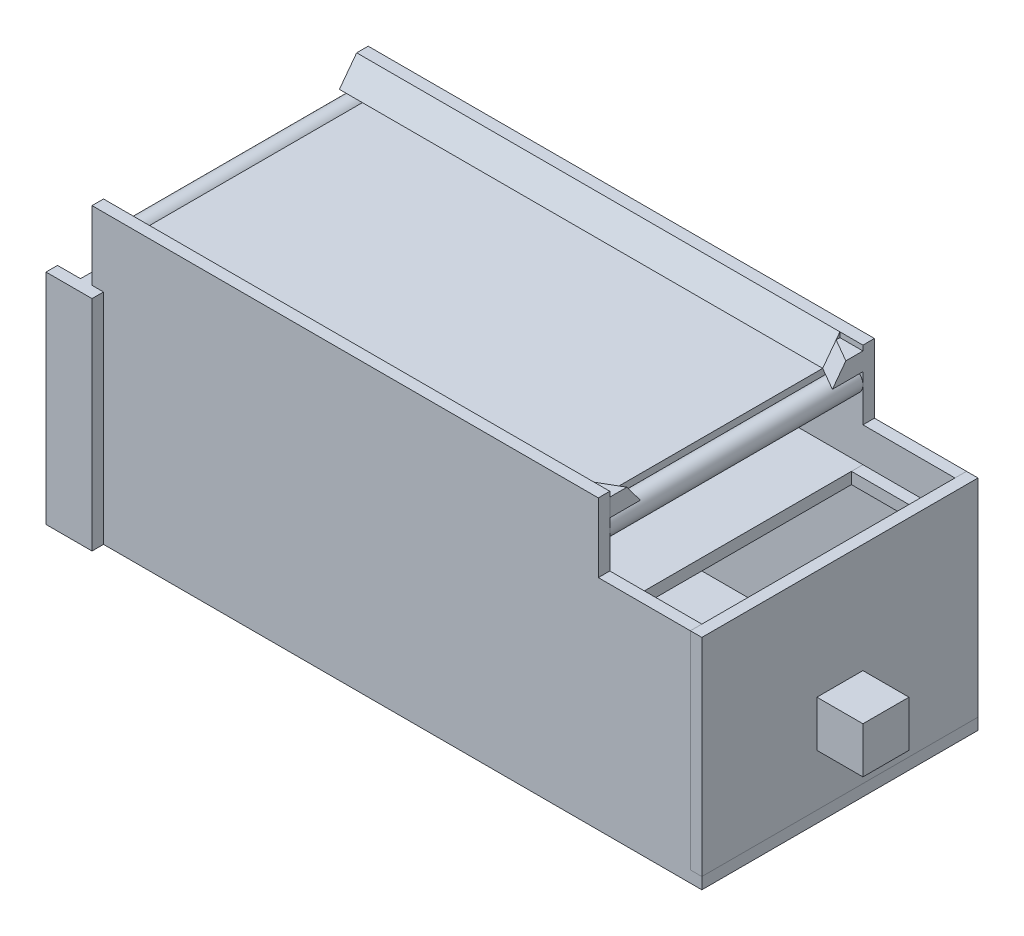
from build123d import *

# Parameters (mm, degrees)
SKETCH1_W                             = 584.2
SKETCH1_H                             = 304.8
SKETCH1_W_2                           = 101.6
FOND_DEPTH                            = 12.7
SKETCH2_W                             = 660.4
SKETCH2_H                             = 12.7
COT_S_HAUT_DEPTH                      = 228.6
COT_S_HAUT_2_DEPTH                    = 228.6
SKETCH3_W                             = 12.7
SKETCH3_H                             = 304.8
COT_ES_BAS_DEPTH                      = 228.6
COT_ES_BAS_2_DEPTH                    = 228.6
SKETCH4_W                             = 558.8
SKETCH4_H                             = 12.7
SUPPORT_CAGE_DEPTH                    = 76.2
SKETCH5_W                             = 12.7
SKETCH5_H                             = 12.7
SUPPORT_TRAPPE_COT_ES_DEPTH           = 101.6
SUPPORT_TRAPPE_COT_ES_2_DEPTH         = 101.6
SUPPORT_TRAPPE_DEVANT_REACH           = 579.815
SKETCH6_W                             = 12.7
SKETCH6_H                             = 12.7
PLANCHER_MILLIEU_REACH                = 586.062
SKETCH7_W                             = 558.8
SKETCH7_H                             = 12.7
ROULEAU_REACH                         = 586.062
SKETCH8_R                             = 12.7
SKETCH10_W                            = 508
SKETCH10_H                            = 12.7
SOUTIEN_TAPIS_DEPTH                   = 279.4
REBORD_START                          = -25.4
REBORD_TAPIS_DEPTH                    = 533.4
V_POUR_VIS_SANS_FIN_DEPTH             = 177.8
TROU_V_VIS_SANS_FIN_REACH             = 530.235
SKETCH17_W                            = 25.4
SKETCH17_H                            = 19.05
TROU_V_VIS_SANS_FIN_DIRECTION_2_REACH = 530.235
TROU_SORTIE_VIS_SANS_FIN_DEPTH        = 12.7
TROU_SORTIE_VIS_SANS_FIN_DEPTH_BACK   = 12.7
SKETCH18_W                            = 12.7
SKETCH18_H                            = 25.4
SKETCH19_W                            = 12.7
SKETCH19_H                            = 241.3
REBORD_POUR_SAC_POUBELLE_DEPTH        = 25.4
SKETCH31_W                            = 50.8
SKETCH31_H                            = 50.8
BOITE_MOTEUR_VIS_SANS_DEPTH           = 50.8


with BuildPart() as part:
    # Sketch1 → Fond (new body)
    with BuildSketch(Plane(origin=(0, 0, 0), x_dir=(1, 0, 0), z_dir=(0, 1, 0))):
        Rectangle(SKETCH1_W, SKETCH1_H)
        with Locations((342.9, 0)):
            Rectangle(SKETCH1_W_2, SKETCH1_H)
    extrude(amount=FOND_DEPTH)


with BuildPart() as body_2:
    # Sketch2 → Cotés Haut (new body)
    with BuildSketch(Plane(origin=(0, 12.7, 0), x_dir=(1, 0, 0), z_dir=(0, 1, 0))):
        with Locations((50.8, 146.05)):
            Rectangle(SKETCH2_W, SKETCH2_H)
    extrude(amount=COT_S_HAUT_DEPTH)



with BuildPart() as body_3:
    # Sketch2 → Cot_s Haut 2 (new body)
    with BuildSketch(Plane(origin=(0, 12.7, 0), x_dir=(1, 0, 0), z_dir=(0, 1, 0))):
        with Locations((50.8, -146.05)):
            Rectangle(SKETCH2_W, SKETCH2_H)
    extrude(amount=COT_S_HAUT_2_DEPTH)


with BuildPart() as body_4:
    # Sketch3 → Cotées Bas (new body)
    with BuildSketch(Plane(origin=(0, 12.7, 0), x_dir=(1, 0, 0), z_dir=(0, 1, 0))):
        with Locations((-285.75, 0)):
            Rectangle(SKETCH3_W, SKETCH3_H)
    extrude(amount=COT_ES_BAS_DEPTH)


with BuildPart() as body_5:
    # Sketch3 → Cot_es Bas 2 (new body)
    with BuildSketch(Plane(origin=(0, 12.7, 0), x_dir=(1, 0, 0), z_dir=(0, 1, 0))):
        with Locations((387.35, 0)):
            Rectangle(SKETCH3_W, SKETCH3_H)
    extrude(amount=COT_ES_BAS_2_DEPTH)

    # Sketch18 → Trou sortie vis sans fin (cut, two sides: drawn at the far end of the back side and taken through both)
    with BuildSketch(Plane.XY.offset(-TROU_SORTIE_VIS_SANS_FIN_DEPTH_BACK)):
        with Locations((387.35, 101.6)):
            Rectangle(SKETCH18_W, SKETCH18_H)
    extrude(amount=TROU_SORTIE_VIS_SANS_FIN_DEPTH + TROU_SORTIE_VIS_SANS_FIN_DEPTH_BACK, mode=Mode.SUBTRACT)

    # Sketch31 → Boite moteur vis sans (add)
    with BuildSketch(Plane(origin=(393.7, 0, 0), x_dir=(0, 0, -1), z_dir=(1, 0, 0))):
        with Locations((0, 95.25)):
            Rectangle(SKETCH31_W, SKETCH31_H)
    extrude(amount=BOITE_MOTEUR_VIS_SANS_DEPTH)


with BuildPart() as body_2_1:
    add(body_2.part)

    add(body_3.part)  # Support Cage merges body 3
    # Sketch4 → Support Cage (add)
    with BuildSketch(Plane(origin=(0, 241.3, 0), x_dir=(1, 0, 0), z_dir=(0, 1, 0))):
        with Locations((0, 146.05)):
            Rectangle(SKETCH4_W, SKETCH4_H)
        with Locations((0, -146.05)):
            Rectangle(SKETCH4_W, SKETCH4_H)
    extrude(amount=SUPPORT_CAGE_DEPTH)


with BuildPart() as body_5_2:
    # Sketch5 → Support Trappe cotées (new body)
    with BuildSketch(Plane.ZY.offset(-381)):
        with Locations((-133.35, 196.85)):
            Rectangle(SKETCH5_W, SKETCH5_H)
    extrude(amount=SUPPORT_TRAPPE_COT_ES_DEPTH)


with BuildPart() as body_6:
    # Sketch5 → Support Trappe cot_es 2 (new body)
    with BuildSketch(Plane.ZY.offset(-381)):
        with Locations((133.35, 196.85)):
            Rectangle(SKETCH5_W, SKETCH5_H)
    extrude(amount=SUPPORT_TRAPPE_COT_ES_2_DEPTH)


with BuildPart() as body_7:

    # Sketch6 → Support Trappe devant (new, up to next)
    with BuildSketch(Plane.XY.offset(-127), mode=Mode.PRIVATE) as support_trappe_devant_sk1:
        with Locations((374.65, 196.85)):
            Rectangle(SKETCH6_W, SKETCH6_H)
    support_trappe_devant_tool1 = extrude(support_trappe_devant_sk1.sketch, amount=SUPPORT_TRAPPE_DEVANT_REACH, mode=Mode.PRIVATE) - body_6.part
    add(support_trappe_devant_tool1.solids().sort_by_distance((374.65, 196.85, -127))[0])


with BuildPart() as body_8:

    # Sketch7 → Plancher millieu (new, up to next)
    with BuildSketch(Plane(origin=(0, 0, 139.7), x_dir=(-1, 0, 0), z_dir=(0, 0, -1)), mode=Mode.PRIVATE) as plancher_millieu_sk1:
        with Locations((0, 196.85)):
            Rectangle(SKETCH7_W, SKETCH7_H)
    plancher_millieu_tool1 = extrude(plancher_millieu_sk1.sketch, amount=PLANCHER_MILLIEU_REACH, mode=Mode.PRIVATE) - body_2_1.part
    add(plancher_millieu_tool1.solids().sort_by_distance((0, 196.85, 139.7))[0])


with BuildPart() as body_9:

    # Sketch8 → Rouleau (new, up to next)
    with BuildSketch(Plane(origin=(0, 0, 139.7), x_dir=(-1, 0, 0), z_dir=(0, 0, -1)), mode=Mode.PRIVATE) as rouleau_sk1:
        with Locations((-266.7, 279.4)):
            Circle(SKETCH8_R)
    rouleau_tool1 = extrude(rouleau_sk1.sketch, amount=ROULEAU_REACH, mode=Mode.PRIVATE) - body_2_1.part
    rouleau = rouleau_tool1.solids().sort_by_distance((266.7, 279.4, 139.7))[0]
    add(rouleau)


with BuildPart() as body_2_2:
    add(body_2_1.part)

    # Mirror1: Rouleau across plane
    add(rouleau.mirror(Plane(origin=(0, 0, 0), x_dir=(0, 0, 1), z_dir=(1, 0, 0))))

    # Mirror9 2: loft between two sections, ruled curve by curve
    mirror9_2_from = [
        Edge.make_line((279.4, 311.912, -120.844303163), (279.4, 311.912, -139.7)),
        Edge.make_line((279.4, 292.1, -139.7), (279.4, 292.1, -105.985303163)),
        Edge.make_line((279.4, 292.1, -105.985303163), (279.4, 311.912, -120.844303163)),
        Edge.make_line((279.4, 292.1, -139.7), (279.4, 311.912, -139.7)),
    ]
    mirror9_2_to = [
        Edge.make_line((254, 311.912, -135.509), (254, 311.912, -139.7)),
        Edge.make_line((254, 292.1, -139.7), (254, 292.1, -120.65)),
        Edge.make_line((254, 292.1, -120.65), (254, 311.912, -135.509)),
        Edge.make_line((254, 292.1, -139.7), (254, 311.912, -139.7)),
    ]
    mirror9_2 = Solid(Shell([*[Face.make_surface_from_curves(mirror9_2_from[k], mirror9_2_to[k]) for k in range(4)], Face(Wire(mirror9_2_from)), Face(Wire(mirror9_2_to))]))
    add(mirror9_2)


with BuildPart() as body_10:
    # Sketch10 → Soutien tapis (new body)
    with BuildSketch(Plane(origin=(0, 0, 139.7), x_dir=(-1, 0, 0), z_dir=(0, 0, -1))):
        with Locations((0, 285.75)):
            Rectangle(SKETCH10_W, SKETCH10_H)
    extrude(amount=SOUTIEN_TAPIS_DEPTH)


with BuildPart() as body_11:
    # Sketch11 → Rebord tapis (new body)
    with BuildSketch(Plane(origin=(279.4, 0, 0), x_dir=(0, 0, -1), z_dir=(1, 0, 0)).offset(REBORD_START)):
        Polygon((-139.7, 317.5), (-120.65, 292.1), (-139.7, 292.1), align=None)
    rebord_tapis = extrude(amount=-REBORD_TAPIS_DEPTH)


with BuildPart() as body_10_1:
    add(body_10.part)

    # Mirror5: Rebord tapis across plane
    add(rebord_tapis.mirror(Plane.XY))

    # Mirror9: read off the stored shape, not the designer's step
    # Mirror9: loft between two sections, ruled curve by curve
    mirror9_from = [
        Edge.make_line((279.4, 292.1, -139.7), (279.4, 292.1, -105.985303163)),
        Edge.make_line((279.4, 311.912, -120.844303163), (279.4, 311.912, -139.7)),
        Edge.make_line((279.4, 292.1, -105.985303163), (279.4, 311.912, -120.844303163)),
        Edge.make_line((279.4, 311.912, -139.7), (279.4, 292.1, -139.7)),
    ]
    mirror9_to = [
        Edge.make_line((254, 292.1, -139.7), (254, 292.1, -120.65)),
        Edge.make_line((254, 311.912, -135.509), (254, 311.912, -139.7)),
        Edge.make_line((254, 292.1, -120.65), (254, 311.912, -135.509)),
        Edge.make_line((254, 311.912, -139.7), (254, 292.1, -139.7)),
    ]
    mirror9 = Solid(Shell([*[Face.make_surface_from_curves(mirror9_from[k], mirror9_to[k]) for k in range(4)], Face(Wire(mirror9_from)), Face(Wire(mirror9_to))]))
    add(mirror9)


with BuildPart() as body_12:
    # Sketch13 → V pour vis sans fin (new body)
    with BuildSketch(Plane(origin=(0, 12.7, 0), x_dir=(1, 0, 0), z_dir=(0, 1, 0))):
        Polygon((-190.447909488, 0), (-234.442, 25.4), (-234.442, -25.4), align=None)
    extrude(amount=V_POUR_VIS_SANS_FIN_DEPTH)

    # Trou V vis sans fin: up to this face of the body (flat: up to its plane)
    trou_v_vis_sans_fin_end = Plane(body_12.part.faces().sort_by_distance((-212.444954744, 101.6, -12.7))[0])
    # Sketch17 → Trou V vis sans fin (cut, up to the picked face)
    with BuildSketch(Plane.XY, mode=Mode.PRIVATE) as trou_v_vis_sans_fin_sk1:
        with Locations((-203.147909488, 101.6)):
            Rectangle(SKETCH17_W, SKETCH17_H)
    trou_v_vis_sans_fin_tool1 = split(extrude(trou_v_vis_sans_fin_sk1.sketch, amount=-TROU_V_VIS_SANS_FIN_REACH, mode=Mode.PRIVATE), bisect_by=trou_v_vis_sans_fin_end, keep=Keep.BOTH, mode=Mode.PRIVATE)
    add(trou_v_vis_sans_fin_tool1.solids().sort_by(Axis((-203.147909, 101.6, 0), (0, 0, -1)))[0], mode=Mode.SUBTRACT)

    # Trou V vis sans fin direction 2: up to this face of the body (flat: up to its plane)
    trou_v_vis_sans_fin_direction_2_end = Plane(body_12.part.faces().sort_by_distance((-212.444954744, 101.6, 12.7))[0])
    # Sketch17 → Trou V vis sans fin direction 2 (cut, up to the picked face)
    with BuildSketch(Plane.XY, mode=Mode.PRIVATE) as trou_v_vis_sans_fin_direction_2_sk1:
        with Locations((-203.147909488, 101.6)):
            Rectangle(SKETCH17_W, SKETCH17_H)
    trou_v_vis_sans_fin_direction_2_tool1 = split(extrude(trou_v_vis_sans_fin_direction_2_sk1.sketch, amount=TROU_V_VIS_SANS_FIN_DIRECTION_2_REACH, mode=Mode.PRIVATE), bisect_by=trou_v_vis_sans_fin_direction_2_end, keep=Keep.BOTH, mode=Mode.PRIVATE)
    add(trou_v_vis_sans_fin_direction_2_tool1.solids().sort_by(Axis((-203.147909, 101.6, 0), (0, 0, 1)))[0], mode=Mode.SUBTRACT)


with BuildPart() as body_13:
    # Sketch19 → Rebord pour sac poubelle (new, symmetric)
    with BuildSketch(Plane.ZY.offset(292.1)):
        with Locations((-158.75, 120.65)):
            Rectangle(SKETCH19_W, SKETCH19_H)
    rebord_pour_sac_poubelle = extrude(amount=REBORD_POUR_SAC_POUBELLE_DEPTH, both=True)


with BuildPart() as body_14:
    # Rebord pour sac poubelle 2: read off the stored shape, not the designer's step
    # Rebord pour sac poubelle 2: loft between two sections, ruled curve by curve
    rebord_pour_sac_poubelle_2_from = [
        Edge.make_line((254, 292.1, 120.65), (254, 292.1, 139.7)),
        Edge.make_line((254, 292.1, 139.7), (279.4, 292.1, 139.7)),
        Edge.make_line((279.4, 292.1, 105.985303163), (254, 292.1, 120.65)),
        Edge.make_line((279.4, 292.1, 139.7), (279.4, 292.1, 105.985303163)),
    ]
    rebord_pour_sac_poubelle_2_to = [
        Edge.make_line((254, 311.912, 135.509), (254, 311.912, 139.7)),
        Edge.make_line((254, 311.912, 139.7), (279.4, 311.912, 139.7)),
        Edge.make_line((279.4, 311.912, 120.844303163), (254, 311.912, 135.509)),
        Edge.make_line((279.4, 311.912, 139.7), (279.4, 311.912, 120.844303163)),
    ]
    rebord_pour_sac_poubelle_2 = Solid(Shell([*[Face.make_surface_from_curves(rebord_pour_sac_poubelle_2_from[k], rebord_pour_sac_poubelle_2_to[k]) for k in range(4)], Face(Wire(rebord_pour_sac_poubelle_2_from)), Face(Wire(rebord_pour_sac_poubelle_2_to))]))
    add(rebord_pour_sac_poubelle_2)


with BuildPart() as part_1:
    add(part.part)

    add(body_2_2.part)  # Mirror11 merges body 2

    add(body_4.part)  # Mirror11 merges body 4
    # Mirror11: Rebord pour sac poubelle across plane
    add(rebord_pour_sac_poubelle.mirror(Plane.XY))


solid = Compound([body_5.part, body_5_2.part, body_6.part, body_7.part, body_8.part, body_9.part, body_11.part, body_10_1.part, body_12.part, body_13.part, body_14.part, part_1.part])
